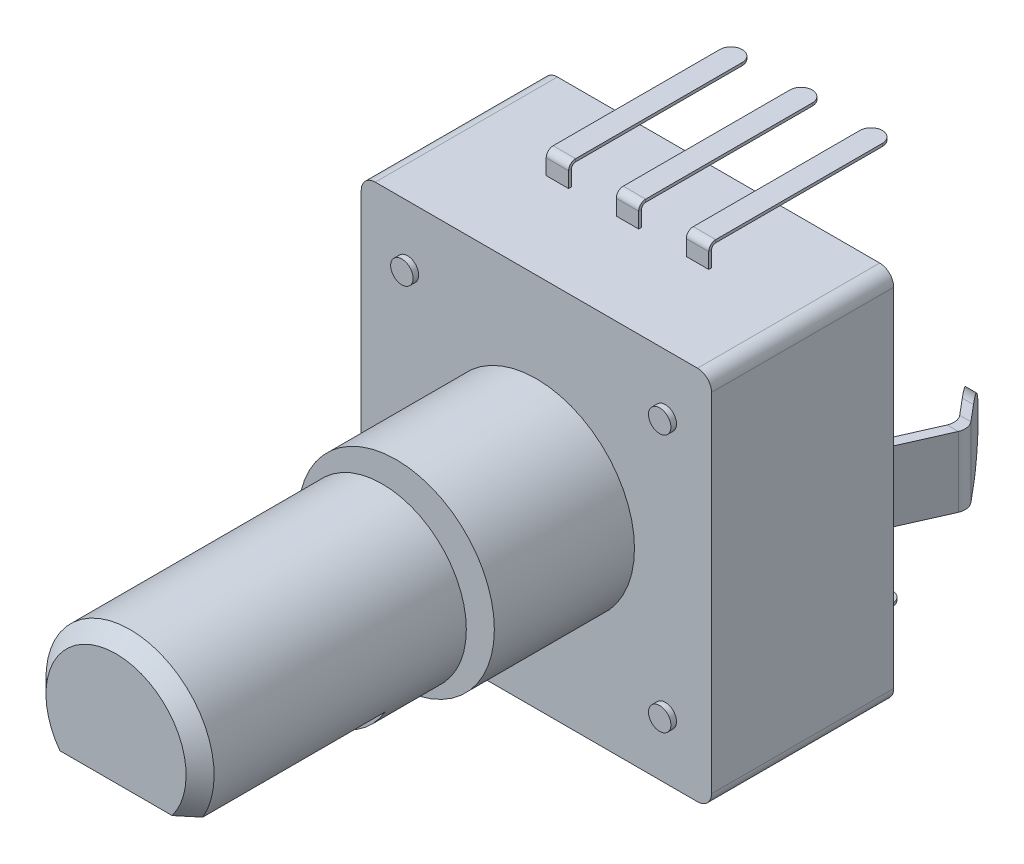
from build123d import *

# Parameters (mm, degrees)
EXTRUDE_1_DEPTH     = 6.5
SKETCH_2_R          = 0.4
EXTRUDE_2_DEPTH     = 0.2
SKETCH_3_R          = 3.5
EXTRUDE_3_DEPTH     = 5
SKETCH_4_R          = 3
EXTRUDE_5_DEPTH     = 10
SKETCH_5_W          = 6.52724622
SKETCH_5_H          = 2.89226862
CUT_EXTRUDE_1_DEPTH = 7
CHAMFER_1_SIZE      = 0.5
SKETCH_6_R          = 3.145240335
SKETCH_6_R_2        = 2.148425486
CUT_EXTRUDE_2_DEPTH = 0.5
SWEEP_START         = -1.25
SWEEP_12_DEPTH      = 2.5
SWEEP_START_2       = -1.200661392
SWEEP_13_DEPTH      = 2.5
SKETCH_13_W         = 0.8
SKETCH_13_H         = 0.1
SKETCH_14_W         = 0.8
SKETCH_14_H         = 0.1
FILLET_1_R          = 0.4
FILLET_2_R          = 1


# Read off the part's stored shape, not the designer's step: По траектории12, По траектории13
# Some blends are built 0.0001 mm under size
with BuildPart() as part:
    # Эскиз1 → Бобышка-Вытянуть1 (new body)
    with BuildSketch(Plane.XY):
        with BuildLine():
            Line((-5.75, 6.7), (5.75, 6.7))
            ThreePointArc((5.75, 6.7), (6.103553391, 6.553553391), (6.25, 6.2))
            Line((6.25, 6.2), (6.25, -6.2))
            ThreePointArc((6.25, -6.2), (6.103553391, -6.553553391), (5.75, -6.7))
            Line((5.75, -6.7), (-5.75, -6.7))
            ThreePointArc((-5.75, -6.7), (-6.103553391, -6.553553391), (-6.25, -6.2))
            Line((-6.25, -6.2), (-6.25, 6.2))
            ThreePointArc((-6.25, 6.2), (-6.103553391, 6.553553391), (-5.75, 6.7))
        make_face()
    extrude(amount=EXTRUDE_1_DEPTH)

    # Эскиз2 → Бобышка-Вытянуть2 (add)
    with BuildSketch(Plane.XY.offset(6.5)):
        with Locations((-4.6, 4.6)):
            Circle(SKETCH_2_R)
        with Locations((4.6, 4.6)):
            Circle(SKETCH_2_R)
        with Locations((4.6, -4.6)):
            Circle(SKETCH_2_R)
        with Locations((-4.6, -4.6)):
            Circle(SKETCH_2_R)
    extrude(amount=EXTRUDE_2_DEPTH)

    # Эскиз3 → Бобышка-Вытянуть3 (add)
    with BuildSketch(Plane.XY.offset(6.5)):
        Circle(SKETCH_3_R)
    extrude(amount=EXTRUDE_3_DEPTH)

    # Эскиз4 → Бобышка-Вытянуть5 (add)
    with BuildSketch(Plane.XY.offset(11.5)):
        Circle(SKETCH_4_R)
    extrude(amount=EXTRUDE_5_DEPTH)

    # Эскиз5 → Вырез-Вытянуть1 (cut)
    with BuildSketch(Plane.XY.offset(21.5)):
        with Locations((0, -2.94613431)):
            Rectangle(SKETCH_5_W, SKETCH_5_H)
    extrude(amount=-CUT_EXTRUDE_1_DEPTH, mode=Mode.SUBTRACT)

    # Фаска1
    chamfer_1_edges = [part.edges().sort_by_distance(p)[0] for p in [
        (-0.776457135, 2.897777479, 21.5),
    ]]
    chamfer(chamfer_1_edges, length=CHAMFER_1_SIZE)

    # Эскиз6 → Вырез-Вытянуть2 (cut)
    with BuildSketch(Plane.XY.offset(11.5)):
        Circle(SKETCH_6_R)
        Circle(SKETCH_6_R_2, mode=Mode.SUBTRACT)
    extrude(amount=CUT_EXTRUDE_2_DEPTH, mode=Mode.SUBTRACT)

    # По траектории12 outline → По траектории12 (add)
    with BuildSketch(Plane(origin=(0, 0, 0), x_dir=(1, 0, 0), z_dir=(0, 1, 0)).offset(SWEEP_START)):
        with BuildLine():
            Line((-5.85, 0), (-6.557222106, 1.597963985))
            add(Edge.make_bspline(
                [(-6.557222106, 1.597963985), (-6.632428218, 1.767891731), (-6.602440024, 1.979444008), (-6.482970147, 2.121775827)],
                knots=[0.400295136, 0.400295136, 0.400295136, 0.400295136, 0.527997483, 0.527997483, 0.527997483, 0.527997483], degree=3))
            Line((-6.482970147, 2.121775827), (-5.158247051, 3.7))
            Line((-5.158247051, 3.7), (-5.558247051, 3.7))
            Line((-5.558247051, 3.7), (-6.882970147, 2.121775827))
            add(Edge.make_bspline(
                [(-6.957222106, 1.597963985), (-7.032428218, 1.767891731), (-7.002440024, 1.979444008), (-6.882970147, 2.121775827)],
                knots=[0.400295136, 0.400295136, 0.400295136, 0.400295136, 0.527997483, 0.527997483, 0.527997483, 0.527997483], degree=3))
            Line((-6.957222106, 1.597963985), (-6.25, 0))
            Line((-6.25, 0), (-5.85, 0))
        make_face()
    extrude(amount=SWEEP_12_DEPTH)

    # По траектории13 outline → По траектории13 (add)
    with BuildSketch(Plane(origin=(0, 0, 0), x_dir=(1, 0, 0), z_dir=(0, 1, 0)).offset(SWEEP_START_2)):
        with BuildLine():
            Line((6.25, 0), (6.957222106, 1.597963985))
            add(Edge.make_bspline(
                [(6.957222106, 1.597963985), (7.032428218, 1.767891731), (7.002440024, 1.979444008), (6.882970147, 2.121775827)],
                knots=[0.400295136, 0.400295136, 0.400295136, 0.400295136, 0.527997483, 0.527997483, 0.527997483, 0.527997483], degree=3))
            Line((6.882970147, 2.121775827), (5.558247051, 3.7))
            Line((5.558247051, 3.7), (5.158247051, 3.7))
            Line((5.158247051, 3.7), (6.482970147, 2.121775827))
            add(Edge.make_bspline(
                [(6.557222106, 1.597963985), (6.632428218, 1.767891731), (6.602440024, 1.979444008), (6.482970147, 2.121775827)],
                knots=[0.400295136, 0.400295136, 0.400295136, 0.400295136, 0.527997483, 0.527997483, 0.527997483, 0.527997483], degree=3))
            Line((6.557222106, 1.597963985), (5.85, 0))
            Line((5.85, 0), (6.25, 0))
        make_face()
    extrude(amount=SWEEP_13_DEPTH)

    # По траектории14: sweep along a path in Эскиз15
    with BuildLine(Plane(origin=(0, 0, 0), x_dir=(0, 0, -1), z_dir=(1, 0, 0))) as sweep_14_path:
        Line((3.7, -7), (0, -7))
        ThreePointArc((0, -7), (-0.212132034, -6.912132034), (-0.3, -6.7))
    # Эскиз13 → По траектории14 (sweep)
    with BuildSketch(Plane(origin=(0, 0, 0), x_dir=(-1, 0, 0), z_dir=(0, 0, -1))):
        with Locations((2.5, -6.95)):
            Rectangle(SKETCH_13_W, SKETCH_13_H)
        with Locations((-2.5, -6.95)):
            Rectangle(SKETCH_13_W, SKETCH_13_H)
    sweep(path=sweep_14_path.line)

    # По траектории15: sweep along a path in Эскиз16
    with BuildLine(Plane(origin=(0, 0, 0), x_dir=(0, 0, -1), z_dir=(1, 0, 0))) as sweep_15_path:
        Line((3.344273236, 7.5), (0, 7.5))
        Line((0, 7.5), (-3, 7.5))
        ThreePointArc((-3, 7.5), (-3.176776695, 7.426776695), (-3.25, 7.25))
        Line((-3.25, 7.25), (-3.25, 6.7))
    # Эскиз14 → По траектории15 (sweep)
    with BuildSketch(Plane(origin=(0, 0, 0), x_dir=(-1, 0, 0), z_dir=(0, 0, -1))):
        with Locations((2.5, 7.45)):
            Rectangle(SKETCH_14_W, SKETCH_14_H)
        with Locations((0, 7.45)):
            Rectangle(SKETCH_14_W, SKETCH_14_H)
        with Locations((-2.5, 7.45)):
            Rectangle(SKETCH_14_W, SKETCH_14_H)
    sweep(path=sweep_15_path.line)

    # Скругление1
    fillet_1_edges = [part.edges().sort_by_distance(p)[0] for p in [
        (-2.9, -6.95, -3.7),
        (-2.1, -6.95, -3.7),
        (2.1, -6.95, -3.7),
        (2.9, -6.95, -3.7),
        (-2.9, 7.45, -3.344273236),
        (-2.1, 7.45, -3.344273236),
        (0.4, 7.45, -3.344273236),
        (-0.4, 7.45, -3.344273236),
        (2.1, 7.45, -3.344273236),
        (2.9, 7.45, -3.344273236),
    ]]
    fillet(fillet_1_edges, radius=FILLET_1_R - 0.0001)  # a hair under: the kernel refuses the full size

    # Скругление2
    # the kernel refuses this fillet: 1 mm, written as the material it takes off along each edge
    with BuildSketch(Plane(origin=(8.058247051, -1.200661392, -3.7), x_dir=(0, 0, 1), z_dir=(-1, 0, 0)), Plane(origin=(-2.658247051, -1.25, -3.7), x_dir=(0, 0, 1), z_dir=(-1, 0, 0))) as fillet_2_piece_1:
        with BuildLine():
            CenterArc((FILLET_2_R, FILLET_2_R), FILLET_2_R, 180, 90)
            Line((0, FILLET_2_R), (0, 0))
            Line((0, 0), (FILLET_2_R, 0))
        make_face()
    extrude(amount=5.4, mode=Mode.SUBTRACT)
    with BuildSketch(Plane(origin=(8.058247051, 1.299338608, -3.7), x_dir=(0, 0, 1), z_dir=(-1, 0, 0)), Plane(origin=(-2.658247051, 1.25, -3.7), x_dir=(0, 0, 1), z_dir=(-1, 0, 0))) as fillet_2_piece_2:
        with BuildLine():
            CenterArc((FILLET_2_R, -FILLET_2_R), FILLET_2_R, 90, 90)
            Line((0, -FILLET_2_R), (0, 0))
            Line((0, 0), (FILLET_2_R, 0))
        make_face()
    extrude(amount=5.4, mode=Mode.SUBTRACT)


solid = part.part
